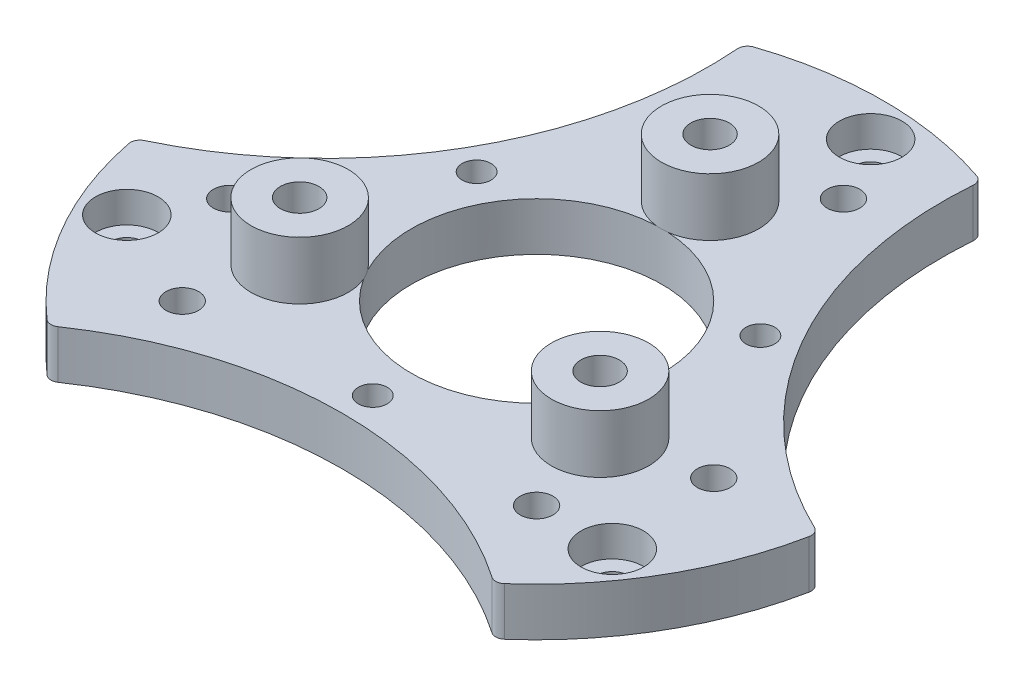
from build123d import *

# Parameters (mm, degrees)
SKETCH1_R           = 36
SKETCH1_R_2         = 13
BOSS_EXTRUDE1_DEPTH = 5
SKETCH2_R           = 1.65
CUT_EXTRUDE1_DEPTH  = 52.15662225
CIRPATTERN1_COUNT   = 3
SKETCH3_R           = 39.833252513
CUT_EXTRUDE2_DEPTH  = 10
CIRPATTERN2_COUNT   = 3
FILLET1_R           = 1
SKETCH4_R           = 5.05
BOSS_EXTRUDE2_DEPTH = 6
SKETCH7_R           = 3.25
CUT_EXTRUDE5_DEPTH  = 3.2
CIRPATTERN3_COUNT   = 3
SKETCH8_R           = 1.5
CUT_EXTRUDE6_DEPTH  = 10
SKETCH12_R          = 2
CUT_EXTRUDE8_DEPTH  = 52.623802313
CIRPATTERN4_COUNT   = 3
SKETCH13_R          = 1.7
CUT_EXTRUDE9_DEPTH  = 51.793867377
CIRPATTERN5_COUNT   = 3


with BuildPart() as part:
    # Sketch1 → Boss-Extrude1 (new body)
    with BuildSketch(Plane(origin=(0, 0, 0), x_dir=(1, 0, 0), z_dir=(0, 1, 0))):
        Circle(SKETCH1_R)
        Circle(SKETCH1_R_2, mode=Mode.SUBTRACT)
    extrude(amount=BOSS_EXTRUDE1_DEPTH)

    # Sketch2 → Cut-Extrude1 (cut, through all)
    with BuildSketch(Plane(origin=(0, 5, 0), x_dir=(1, 0, 0), z_dir=(0, 1, 0))):
        with Locations((2.788983768, 31.878230339)):
            Circle(SKETCH2_R)
    cut_extrude1 = extrude(amount=-CUT_EXTRUDE1_DEPTH, mode=Mode.SUBTRACT)

    # CirPattern1: Cut-Extrude1 ×3 about axis
    cirpattern1_axis = Axis((0, 5, 0), (0, -1, 0))
    for i in range(1, CIRPATTERN1_COUNT):
        add(cut_extrude1.rotate(cirpattern1_axis, i * 360 / CIRPATTERN1_COUNT), mode=Mode.SUBTRACT)

    # Sketch3 → Cut-Extrude2 (cut)
    with BuildSketch(Plane(origin=(0, 5, 0), x_dir=(1, 0, 0), z_dir=(0, 1, 0))):
        with Locations((51.961524227, 30)):
            Circle(SKETCH3_R)
    cut_extrude2 = extrude(amount=-CUT_EXTRUDE2_DEPTH, mode=Mode.SUBTRACT)

    # CirPattern2: Cut-Extrude2 ×3 about axis
    cirpattern2_axis = Axis((0, 5, 0), (0, -1, 0))
    for i in range(1, CIRPATTERN2_COUNT):
        add(cut_extrude2.rotate(cirpattern2_axis, i * 360 / CIRPATTERN2_COUNT), mode=Mode.SUBTRACT)

    # Fillet1
    fillet1_edges = [part.edges().sort_by_distance(p)[0] for p in [
        (23.140353949, 2.5, 27.577599952),
        (-23.140353949, 2.5, 27.577599952),
        (-35.453079108, 2.5, 6.251334396),
        (-12.31272516, 2.5, -33.828934348),
        (35.453079108, 2.5, 6.251334396),
        (12.31272516, 2.5, -33.828934348),
    ]]
    fillet(fillet1_edges, radius=FILLET1_R)

    # Sketch4 → Boss-Extrude2 (add)
    with BuildSketch(Plane(origin=(0, 5, 0), x_dir=(1, 0, 0), z_dir=(0, 1, 0))):
        with Locations((0, 18)):
            Circle(SKETCH4_R)
    boss_extrude2 = extrude(amount=BOSS_EXTRUDE2_DEPTH)

    # Sketch7 → Cut-Extrude5 (cut)
    with BuildSketch(Plane(origin=(0, 5, 0), x_dir=(1, 0, 0), z_dir=(0, 1, 0))):
        with Locations((2.788983768, 31.878230339)):
            Circle(SKETCH7_R)
    cut_extrude5 = extrude(amount=-CUT_EXTRUDE5_DEPTH, mode=Mode.SUBTRACT)

    # CirPattern3: Boss-Extrude2, Cut-Extrude5 ×3 about axis
    cirpattern3_axis = Axis((0, 5, 0), (0, -1, 0))
    add([boss_extrude2.rotate(cirpattern3_axis, i * 360 / CIRPATTERN3_COUNT) for i in range(1, CIRPATTERN3_COUNT)])
    add([cut_extrude5.rotate(cirpattern3_axis, i * 360 / CIRPATTERN3_COUNT) for i in range(1, CIRPATTERN3_COUNT)], mode=Mode.SUBTRACT)

    # Sketch8 → Cut-Extrude6 (cut)
    with BuildSketch(Plane(origin=(0, 5, 0), x_dir=(1, 0, 0), z_dir=(0, 1, 0))):
        with Locations((14.722431864, 8.5)):
            Circle(SKETCH8_R)
    cut_extrude6 = extrude(amount=-CUT_EXTRUDE6_DEPTH, mode=Mode.SUBTRACT)

    # Sketch12 → Cut-Extrude8 (cut, through all)
    with BuildSketch(Plane(origin=(0, 11, 0), x_dir=(1, 0, 0), z_dir=(0, 1, 0))):
        with Locations((0, 18)):
            Circle(SKETCH12_R)
    cut_extrude8 = extrude(amount=-CUT_EXTRUDE8_DEPTH, mode=Mode.SUBTRACT)

    # CirPattern4: Cut-Extrude6, Cut-Extrude8 ×3 about axis
    cirpattern4_axis = Axis((0, 5, 0), (0, -1, 0))
    add([cut_extrude6.rotate(cirpattern4_axis, i * 360 / CIRPATTERN4_COUNT) for i in range(1, CIRPATTERN4_COUNT)], mode=Mode.SUBTRACT)
    add([cut_extrude8.rotate(cirpattern4_axis, i * 360 / CIRPATTERN4_COUNT) for i in range(1, CIRPATTERN4_COUNT)], mode=Mode.SUBTRACT)

    # Sketch13 → Cut-Extrude9 (cut, through all)
    with BuildSketch(Plane(origin=(0, 5, 0), x_dir=(1, 0, 0), z_dir=(0, 1, 0))):
        with Locations((6.729295173, 25.114071484)):
            Circle(SKETCH13_R)
        with Locations((-6.729295173, 25.114071484)):
            Circle(SKETCH13_R)
    cut_extrude9 = extrude(amount=-CUT_EXTRUDE9_DEPTH, mode=Mode.SUBTRACT)

    # CirPattern5: Cut-Extrude9 ×3 about axis
    cirpattern5_axis = Axis((0, 5, 0), (0, -1, 0))
    for i in range(1, CIRPATTERN5_COUNT):
        add(cut_extrude9.rotate(cirpattern5_axis, i * 360 / CIRPATTERN5_COUNT), mode=Mode.SUBTRACT)


solid = part.part
